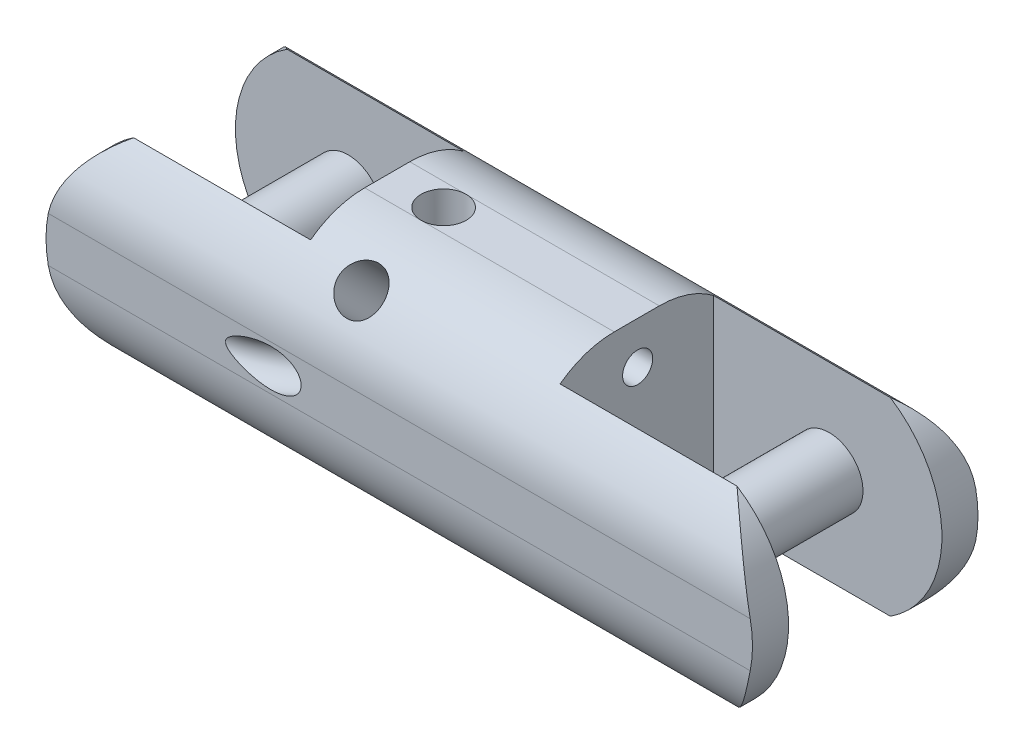
from build123d import *

# Parameters (mm, degrees)
BOSS_EXTRUDE1_DEPTH  = 47
SKETCH3_W            = 15.2
SKETCH3_H            = 3.6
SKETCH3_H_2          = 1.5
CUT_EXTRUDE1_DEPTH   = 15
SKETCH4_R            = 2.25
BOSS_EXTRUDE2_DEPTH  = 10.2
CUT_EXTRUDE4_START   = -16
CUT_EXTRUDE4_DEPTH   = 17
CAVITY2_OUTLINE_R    = 1
CAVITY2_ANGLE        = 4.262624
CAVITY2_2_OUTLINE_R  = 1
CAVITY2_2_ANGLE      = 16.759713
CAVITY2_START        = 14
CAVITY2_3_OUTLINE_R  = 1
CAVITY2_3_DEPTH      = 19
CAVITY2_START_2      = 16.065045633
CAVITY2_4_OUTLINE_R  = 1
CAVITY2_4_DEPTH      = 16.934954367
CUT_SWEEP1_PROFILE_R = 1.25
SKETCH22_R           = 1.5
CUT_EXTRUDE5_DEPTH   = 10
SKETCH23_R           = 1.5
CUT_EXTRUDE6_DEPTH   = 20


with BuildPart() as part:
    # Sketch1 → Boss-Extrude1 (new body)
    with BuildSketch(Plane(origin=(0, 0, 0), x_dir=(0, 0, -1), z_dir=(1, 0, 0))):
        with BuildLine():
            Line((-1.5, -7.5), (1.5, -7.5))
            ThreePointArc((1.5, -7.5), (5.742640687, -5.742640687), (7.5, -1.5))
            Line((7.5, -1.5), (7.5, 1.5))
            ThreePointArc((7.5, 1.5), (5.742640687, 5.742640687), (1.5, 7.5))
            Line((1.5, 7.5), (-1.5, 7.5))
            ThreePointArc((-1.5, 7.5), (-5.742640687, 5.742640687), (-7.5, 1.5))
            Line((-7.5, 1.5), (-7.5, -1.5))
            ThreePointArc((-7.5, -1.5), (-5.742640687, -5.742640687), (-1.5, -7.5))
        make_face()
    extrude(amount=BOSS_EXTRUDE1_DEPTH)

    # Sketch3 → Cut-Extrude1 (cut)
    with BuildSketch(Plane(origin=(0, 7.5, 0), x_dir=(1, 0, 0), z_dir=(0, 1, 0))):
        with Locations((39.4, 3.3)):
            Rectangle(SKETCH3_W, SKETCH3_H)
        with Locations((39.4, 0.75)):
            Rectangle(SKETCH3_W, SKETCH3_H_2)
        with Locations((39.4, -0.75)):
            Rectangle(SKETCH3_W, SKETCH3_H_2)
        with Locations((39.4, -3.3)):
            Rectangle(SKETCH3_W, SKETCH3_H)
    cut_extrude1 = extrude(amount=-CUT_EXTRUDE1_DEPTH, mode=Mode.SUBTRACT)

    # Sketch4 → Boss-Extrude2 (add)
    with BuildSketch(Plane(origin=(0, 0, 5.1), x_dir=(-1, 0, 0), z_dir=(0, 0, -1))):
        with Locations((-39.5, 0)):
            Circle(SKETCH4_R)
    boss_extrude2 = extrude(amount=BOSS_EXTRUDE2_DEPTH)

    # Mirror1: Cut-Extrude1, Boss-Extrude2 across plane
    add(cut_extrude1.mirror(Plane(origin=(23.5, 0, 0), x_dir=(0, 0, 1), z_dir=(1, 0, 0))), mode=Mode.SUBTRACT)
    add(boss_extrude2.mirror(Plane(origin=(23.5, 0, 0), x_dir=(0, 0, 1), z_dir=(1, 0, 0))))

    # Cut-Extrude4: read off the stored shape, not the designer's step
    # Cut-Extrude4 outline → Cut-Extrude4 (cut)
    with BuildSketch(Plane(origin=(0, 0, -7.5), x_dir=(-1, 0, 0), z_dir=(0, 0, -1)).offset(CUT_EXTRUDE4_START)):
        with BuildLine():
            ThreePointArc((-47, 0), (-44.803300859, 5.303300859), (-39.5, 7.5))
            Line((-39.5, 7.5), (-47, 7.5))
            Line((-47, 7.5), (-47, 0))
        make_face()
        with BuildLine():
            ThreePointArc((-39.5, -7.5), (-44.803300859, -5.303300859), (-47, 0))
            Line((-47, 0), (-47, -7.5))
            Line((-47, -7.5), (-39.5, -7.5))
        make_face()
    cut_extrude4 = extrude(amount=CUT_EXTRUDE4_DEPTH, mode=Mode.SUBTRACT)

    # Mirror3: Cut-Extrude4 across plane
    add(cut_extrude4.mirror(Plane(origin=(23.5, 0, 0), x_dir=(0, 0, 1), z_dir=(1, 0, 0))), mode=Mode.SUBTRACT)

    # Cavity2: read off the stored shape, not the designer's step
    # Cavity2 outline → Cavity2 (revolve, cut)
    with BuildSketch(Plane(origin=(15.274321706, 0, -2.058543958), x_dir=(-0.07432820983133852, 0, 0.997233832771065), z_dir=(-0.997233832771065, 0, -0.07432820983133852))):
        with Locations((2, 4.683305038)):
            Circle(CAVITY2_OUTLINE_R)
    revolve(axis=Axis((15.274321706, 0, -2.058543958), (0, 1, 0)), revolution_arc=CAVITY2_ANGLE, mode=Mode.SUBTRACT)

    # Cavity2 2 outline → Cavity2 2 (revolve, cut)
    with BuildSketch(Plane(origin=(16.065045733, 0, 3.941456042), x_dir=(0, 0, -1), z_dir=(1, 0, 0))):
        with Locations((4, -4.623251355)):
            Circle(CAVITY2_2_OUTLINE_R)
    revolve(axis=Axis((16.065045733, 0, 3.941456042), (0, 1, 0)), revolution_arc=CAVITY2_2_ANGLE, mode=Mode.SUBTRACT)

    # Cavity2 3 outline → Cavity2 3 (cut)
    with BuildSketch(Plane.YZ.offset(CAVITY2_START)):
        with Locations((4.683305038, -0.058543958)):
            Circle(CAVITY2_3_OUTLINE_R)
    extrude(amount=CAVITY2_3_DEPTH, mode=Mode.SUBTRACT)

    # Cavity2 4 outline → Cavity2 4 (cut)
    with BuildSketch(Plane.YZ.offset(CAVITY2_START_2)):
        with Locations((-4.623251355, -0.058543958)):
            Circle(CAVITY2_4_OUTLINE_R)
    extrude(amount=CAVITY2_4_DEPTH, mode=Mode.SUBTRACT)

    # Cut-Sweep1: sweep along a curve in space
    with BuildLine() as cut_sweep1_path:
        ThreePointArc((10.956533128, 0, 8.947900116), (18.98511349, 0, 0), (10.956533128, 0, -8.947900116))
    # Cut-Sweep1 profile (on start of the path) → Cut-Sweep1 (sweep, cut)
    with BuildSketch(Plane(origin=(10.956533128, 0, 8.947900116), x_dir=(0.10798842949400878, 0, 0.9941521508780321), z_dir=(0.9941521508780321, 0, -0.10798842949400878))):
        Circle(CUT_SWEEP1_PROFILE_R)
    sweep(path=cut_sweep1_path.line, mode=Mode.SUBTRACT)

    # Sketch22 → Cut-Extrude5 (cut, symmetric)
    with BuildSketch(Plane(origin=(0, 4.5, 4.5), x_dir=(-1, 0, 0), z_dir=(0, -0.7071067811865448, -0.7071067811865502))):
        with Locations(Location((-19.181204573, 0, 0), (0, 0, 90))):
            Circle(SKETCH22_R)
    extrude(amount=CUT_EXTRUDE5_DEPTH, both=True, mode=Mode.SUBTRACT)

    # Sketch23 → Cut-Extrude6 (cut)
    with BuildSketch(Plane(origin=(0, 7.5, 0), x_dir=(1, 0, 0), z_dir=(0, 1, 0))):
        with Locations(Location((18.95, 0, 0), (0, 0, 270))):
            Circle(SKETCH23_R)
    extrude(amount=-CUT_EXTRUDE6_DEPTH, mode=Mode.SUBTRACT)


solid = part.part
